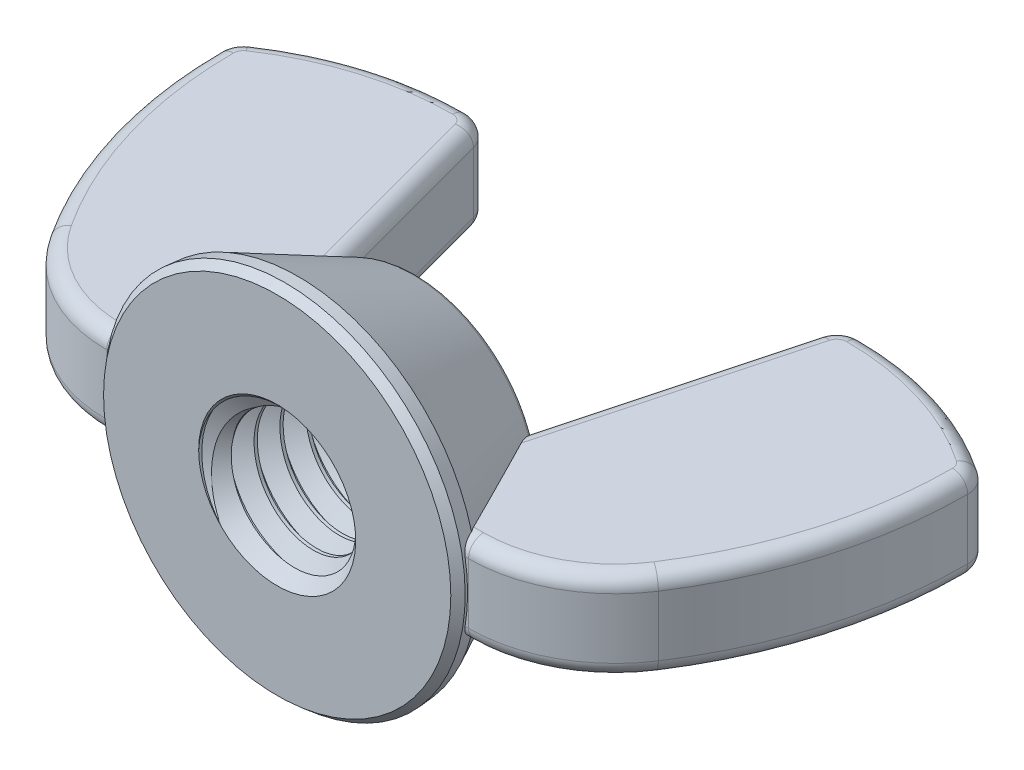
from build123d import *

# Parameters (mm, degrees)
EXTRUDE2_DEPTH     = 1.3890625
SKETCH3_R          = 5.55625
EXTRUDE1_DEPTH     = 0.642937
EXTRUDE1_DRAFT     = -5
SKETCH15_R         = 5.500000257
EXTRUDE3_DEPTH     = 3.643313
EXTRUDE3_TAPER     = 25.800047736
FILLET3_R          = 0.254
SKETCH4_R          = 2.413
CUT_EXTRUDE1_DEPTH = 18.467009361
SWEEP1_PITCH       = 0.79375
SKETCH7_R          = 5.55625
CUT_EXTRUDE2_DEPTH = 18.467009393
SKETCH8_R          = 5.500000257
CUT_EXTRUDE3_DEPTH = 15.879584271
SKETCH11_R         = 2.3622
CUT_EXTRUDE5_DEPTH = 15.879584233
CUT_EXTRUDE5_TAPER = 45
CHAMFER1_SIZE      = 0.241101562
CHAMFER1_SIZE2     = 0.222551774
FILLET4_R          = 0.463020833


with BuildPart() as part:
    # Sketch13 → Extrude2 (new, symmetric)
    with BuildSketch(Plane(origin=(0, 0, 0), x_dir=(1, 0, 0), z_dir=(0, 1, 0))):
        with BuildLine():
            Line((3.41550016, 0.32146875), (5.55625, 0.32146875))
            ThreePointArc((5.55625, 0.32146875), (7.706678674, 0.86730608), (9.336458367, 2.372663188))
            ThreePointArc((9.336458367, 2.372663188), (10.954704307, 5.879259157), (11.509375, 9.701205734))
            ThreePointArc((11.509375, 9.701205734), (11.419045495, 10.063497591), (11.169203551, 10.34097518))
            ThreePointArc((11.169203551, 10.34097518), (8.726277875, 11.506190956), (6.049420309, 11.90625))
            ThreePointArc((6.049420309, 11.90625), (5.579638268, 11.746780486), (5.304014007, 11.334279628))
            Line((5.304014007, 11.334279628), (3.41550016, 4.28625))
            Line((3.41550016, 4.28625), (3.41550016, 0.32146875))
        make_face()
    extrude(amount=EXTRUDE2_DEPTH, both=True)

    # Fillet4
    fillet4_edges = [part.edges().sort_by_distance(p)[0] for p in [
        (7.706678674, 1.3890625, -0.86730608),
        (10.954704307, 1.3890625, -5.879259157),
        (11.419045495, 1.3890625, -10.063497591),
        (8.726277875, 1.3890625, -11.506190956),
        (5.579638268, 1.3890625, -11.746780486),
        (4.359757083, 1.3890625, -7.810264814),
        (4.359757083, -1.3890625, -7.810264814),
        (4.48587508, 1.3890625, -0.32146875),
        (5.579638268, -1.3890625, -11.746780486),
        (8.726277875, -1.3890625, -11.506190956),
        (11.419045495, -1.3890625, -10.063497591),
        (10.954704307, -1.3890625, -5.879259157),
        (7.706678674, -1.3890625, -0.86730608),
        (4.48587508, -1.3890625, -0.32146875),
    ]]
    fillet(fillet4_edges, radius=FILLET4_R)


with BuildPart() as body_2:
    # Sketch3 → Extrude1 (with draft: the straight prism first)
    with BuildSketch(Plane.XY):
        Circle(SKETCH3_R)
    extrude(amount=-EXTRUDE1_DEPTH)
    # Extrude1: the draft: its side faces are tilted about the plane it starts from
    extrude1_sides = [body_2.faces().sort_by_distance(p)[0] for p in [
        (-5.55625, 0, -0.3214685),
    ]]
    draft(extrude1_sides, Plane.XY, EXTRUDE1_DRAFT)


with BuildPart() as extrude3_tool:
    # Sketch15 → Extrude3 (new body)
    with BuildSketch(Plane(origin=(0, 0, -0.6429375), x_dir=(-1, 0, 0), z_dir=(0, 0, -1))):
        Circle(SKETCH15_R)
    extrude(amount=EXTRUDE3_DEPTH, taper=EXTRUDE3_TAPER)


with BuildPart() as body_2_1:
    add(body_2.part)


with BuildPart() as body_2_2:
    # Extrude3: joined with extrude3_tool
    add(body_2_1.part.fuse(extrude3_tool.part, tol=0.00001))

    # Fillet3
    fillet3_edges = [body_2_2.edges().sort_by_distance(p)[0] for p in [
        (3.738750193, 0, -4.2862505),
    ]]
    fillet(fillet3_edges, radius=FILLET3_R)

    # Sketch4 → Cut-Extrude1 (cut, through all)
    with BuildSketch(Plane.XY):
        Circle(SKETCH4_R)
    extrude(amount=-CUT_EXTRUDE1_DEPTH, mode=Mode.SUBTRACT)

    # Sweep1: the profile of Sketch6 profile screwed along a right-hand helix of 9.4 turns, 6 arcs to a turn; built about Z, then put on its axis
    sweep1_z = Axis((0, 0, 0), (0, 0, 1))
    sweep1_corners = [(2.4133, 0, -0.694704455), (1.897444252, 0, -0.396875), (1.897444252, 0, -0.29765625), (2.4133, 0, 0.000173205)]
    with BuildLine(mode=Mode.PRIVATE) as sweep1_profile:
        Line(sweep1_corners[0], sweep1_corners[1])
        Line(sweep1_corners[1], sweep1_corners[2])
        Line(sweep1_corners[2], sweep1_corners[3])
        Line(sweep1_corners[3], sweep1_corners[0])
    sweep1_cap = Face(sweep1_profile.wire())
    sweep1_turn_angles = [0, 30, 60, 90, 120, 150, 180, 210, 240, 270, 300, 330, 360]
    sweep1_turn_weights = [1, 0.8660254037844387, 1, 0.8660254037844387, 1, 0.8660254037844387, 1, 0.8660254037844387, 1, 0.8660254037844387, 1, 0.8660254037844387, 1]
    sweep1_turn_rails = [Edge.make_bspline([Vector(p[0], p[1], 0).rotate(sweep1_z, sweep1_turn_angles[k]) / sweep1_turn_weights[k] + Vector(0, 0, p[2] + SWEEP1_PITCH * sweep1_turn_angles[k] / 360) for k in range(13)], [0, 0, 0, 1, 1, 2, 2, 3, 3, 4, 4, 5, 5, 6, 6, 6], 2, sweep1_turn_weights) for p in sweep1_corners]
    sweep1_turn_sides = [Face.make_surface_from_curves(sweep1_turn_rails[p[0]], sweep1_turn_rails[p[1]]) for p in [(0, 1), (1, 2), (2, 3), (3, 0)]]
    sweep1_last_angles = [3240, 3270, 3300, 3330, 3360, 3372, 3384]
    sweep1_last_weights = [1, 0.8660254037844387, 1, 0.8660254037844387, 1, 0.9781476007338048, 1]
    sweep1_last_rails = [Edge.make_bspline([Vector(p[0], p[1], 0).rotate(sweep1_z, sweep1_last_angles[k]) / sweep1_last_weights[k] + Vector(0, 0, p[2] + SWEEP1_PITCH * sweep1_last_angles[k] / 360) for k in range(7)], [0, 0, 0, 1, 1, 2, 2, 3, 3, 3], 2, sweep1_last_weights) for p in sweep1_corners]
    sweep1_last_sides = [Face.make_surface_from_curves(sweep1_last_rails[p[0]], sweep1_last_rails[p[1]]) for p in [(0, 1), (1, 2), (2, 3), (3, 0)]]
    sweep1 = Plane(origin=(0, 0, 0), x_dir=(-1, 0, 0), z_dir=(0, 0, -1)) * Solid(Shell([*[p.moved(Location((0, 0, SWEEP1_PITCH * i))) for i in range(9) for p in sweep1_turn_sides], *sweep1_last_sides, sweep1_cap, sweep1_cap.rotate(sweep1_z, 3384).moved(Location((0, 0, SWEEP1_PITCH * 3384 / 360)))]))
    add(sweep1)

    # Sketch7 → Cut-Extrude2 (cut, through all)
    with BuildSketch(Plane.XY):
        Circle(SKETCH7_R)
    extrude(amount=CUT_EXTRUDE2_DEPTH, mode=Mode.SUBTRACT)

    # Sketch8 → Cut-Extrude3 (cut, through all)
    with BuildSketch(Plane.XY.offset(-4.28625)):
        Circle(SKETCH8_R)
    extrude(amount=-CUT_EXTRUDE3_DEPTH, mode=Mode.SUBTRACT)

    # Cut-Extrude4 cone 1 section (through the dimple's axis) → Cut-Extrude4 (revolve, cut)
    with BuildSketch(Plane(origin=(0, 0, 0), x_dir=(0, -1, 0), z_dir=(1, 0, 0))):
        Polygon((0, 0), (2.413, 0), (0, 2.413), align=None)
    revolve(axis=Axis((0, 0, 0), (0, 0, -1)), mode=Mode.SUBTRACT)

    # Sketch11 → Cut-Extrude5 (cut, through all)
    with BuildSketch(Plane.XY.offset(-4.28625)):
        Circle(SKETCH11_R)
    extrude(amount=CUT_EXTRUDE5_DEPTH, taper=CUT_EXTRUDE5_TAPER, mode=Mode.SUBTRACT)

    # Chamfer1
    chamfer1_edges = [body_2_2.edges().sort_by_distance(p)[0] for p in [
        (-5.55625, 0, 0),
    ]]
    chamfer1_side = [body_2_2.faces().sort_by_distance(p)[0] for p in [
        (-5.528125151, 0, -0.3214685),
    ]]
    chamfer(chamfer1_edges, length=CHAMFER1_SIZE, length2=CHAMFER1_SIZE2, reference=chamfer1_side[0])


with BuildPart() as body_3:
    # Mirror6: mirrored copy
    add(part.part.mirror(Plane(origin=(0, 0, 0), x_dir=(0, 0, 1), z_dir=(1, 0, 0))))

    # Combine2: union part, body 2
    add(part.part)
    add(body_2_2.part)


solid = body_3.part
